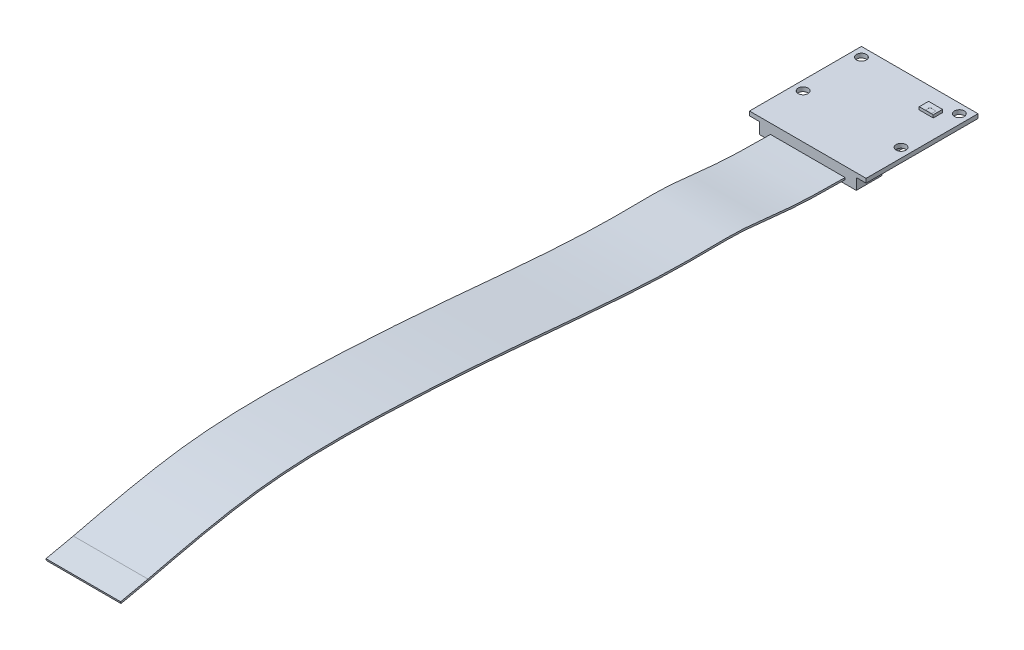
from build123d import *

# Parameters (mm, degrees)
SKIZZE1_W                                 = 25
SKIZZE1_H                                 = 24
PCB_DEPTH                                 = 0.9
SKIZZE2_R                                 = 1.05
MOUNTING_HOLES_DEPTH                      = 20.165333287
SKIZZE3_W                                 = 20.8
SKIZZE3_H                                 = 5.5
CONNECTOR_CLOSED_DEPTH                    = 2.4
SKIZZE4_W                                 = 17.7
SKIZZE4_H                                 = 11.6
COMPONENTS_WORST_CASE_BOUNDARY_BOX_DEPTH  = 1.3
CABLE_156MM_FREE_LENGTH_START             = -8
CABLE_156MM_FREE_LENGTH_DEPTH             = 16
SKIZZE7_W                                 = 3
SKIZZE7_H                                 = 2
COMPONENTS_WORST_CASE_BOUNDARY_BOX2_DEPTH = 0.6
SKIZZE8_W                                 = 1.3
SKIZZE8_H                                 = 0.9
STATUS_LED_DEPTH                          = 0.01


# Read off the part's stored shape, not the designer's step: Cable_156mm_free_Length
with BuildPart() as part:
    # Skizze1 → PCB (new body)
    with BuildSketch(Plane(origin=(0, 0, 0), x_dir=(1, 0, 0), z_dir=(0, 1, 0))):
        with Locations((0, 2.5)):
            Rectangle(SKIZZE1_W, SKIZZE1_H)
    extrude(amount=-PCB_DEPTH)

    # Skizze2 → Mounting_Holes (cut, through all)
    with BuildSketch(Plane(origin=(0, 0, 0), x_dir=(1, 0, 0), z_dir=(0, 1, 0))):
        with Locations(Location((10.5, 12.5, 0), (0, 0, 270))):
            Circle(SKIZZE2_R)
        with Locations(Location((10.5, 0, 0), (0, 0, 270))):
            Circle(SKIZZE2_R)
        with Locations(Location((-10.5, 0, 0), (0, 0, 90))):
            Circle(SKIZZE2_R)
        with Locations(Location((-10.5, 12.5, 0), (0, 0, 90))):
            Circle(SKIZZE2_R)
    extrude(amount=-MOUNTING_HOLES_DEPTH, mode=Mode.SUBTRACT)

    # Skizze3 → Connector_closed (add)
    with BuildSketch(Plane.XZ.offset(0.9)):
        with Locations((0, 6.75)):
            Rectangle(SKIZZE3_W, SKIZZE3_H)
    extrude(amount=CONNECTOR_CLOSED_DEPTH)

    # Skizze4 → Components_worst-case_Boundary-Box (add)
    with BuildSketch(Plane.XZ.offset(0.9)):
        with Locations((-0.15, -6.7)):
            Rectangle(SKIZZE4_W, SKIZZE4_H)
    extrude(amount=COMPONENTS_WORST_CASE_BOUNDARY_BOX_DEPTH)

    # Cable_156mm_free_Length outline → Cable_156mm_free_Length (add)
    with BuildSketch(Plane.YZ.offset(CABLE_156MM_FREE_LENGTH_START)):
        with BuildLine():
            add(Edge.make_bspline(
                [(-2.5, 9.5), (-2.475225113, 12.836586164), (-2.435306032, 18.21273383), (-1.780893788, 25.199891819), (-0.848086938, 32.316273634), (-1.279790623, 43.443994082), (-0.388416893, 60.791916601), (1.903305425, 83.198557796), (3.468421225, 108.473808964), (3.57358047, 134.366469325), (-0.398617572, 150.91775474), (-2.311961718, 158.890243708)],
                knots=[0, 0, 0, 0, 0.066565355, 0.107254889, 0.139591388, 0.210160277, 0.329584285, 0.485565806, 0.660213078, 0.836330084, 1, 1, 1, 1], degree=3))
            Line((-2.5, 9.5), (-2.1, 9.5))
            add(Edge.make_bspline(
                [(-2.1, 9.5), (-2.074945976, 12.831496447), (-2.03457713, 18.199443194), (-1.385285743, 25.13899131), (-0.448711873, 32.285274364), (-0.878853095, 43.46148369), (0.008252641, 60.724222754), (2.300661353, 83.153569069), (3.867117874, 108.441464768), (3.977764902, 134.372552415), (-0.006644422, 150.991885803), (-1.925870548, 158.99715239)],
                knots=[0, 0, 0, 0, 0.066565355, 0.107254889, 0.139591388, 0.210160277, 0.329584285, 0.485565806, 0.660213078, 0.836330084, 1, 1, 1, 1], degree=3))
            Line((-1.925870548, 158.99715239), (-3.203138794, 164.859625062))
            Line((-3.203138794, 164.859625062), (-3.593970306, 164.774473846))
            Line((-3.593970306, 164.774473846), (-2.311961718, 158.890243708))
        make_face()
    extrude(amount=CABLE_156MM_FREE_LENGTH_DEPTH)

    # Skizze7 → Components_worst-case_Boundary-Box2 (add)
    with BuildSketch(Plane(origin=(0, 0, 0), x_dir=(1, 0, 0), z_dir=(0, 1, 0))):
        with Locations((7, 9.9)):
            Rectangle(SKIZZE7_W, SKIZZE7_H)
    extrude(amount=COMPONENTS_WORST_CASE_BOUNDARY_BOX2_DEPTH)

    # Skizze8 → Status_LED (cut)
    with BuildSketch(Plane(origin=(0, 0.6, 0), x_dir=(1, 0, 0), z_dir=(0, 1, 0))):
        with Locations((7.45, 9.45)):
            Rectangle(SKIZZE8_W, SKIZZE8_H)
    extrude(amount=-STATUS_LED_DEPTH, mode=Mode.SUBTRACT)


solid = part.part
